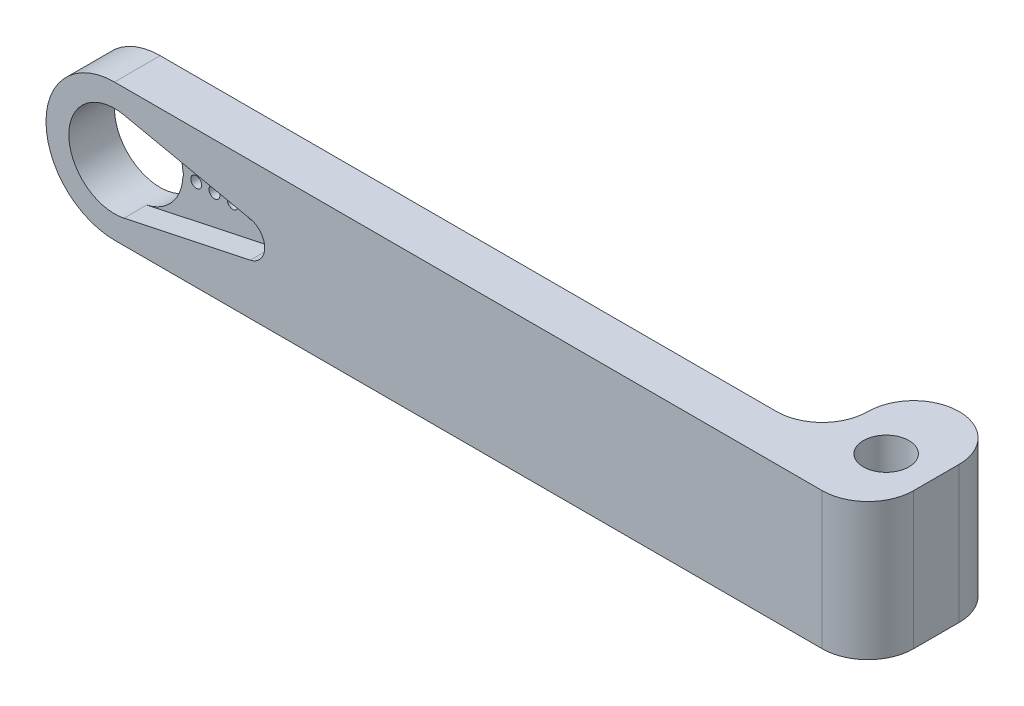
from build123d import *

# Parameters (mm, degrees)
SKETCH1_R           = 5
SKETCH1_R_2         = 2.5
BOSS_EXTRUDE1_DEPTH = 5
SKETCH2_R           = 0.6
CUT_EXTRUDE1_DEPTH  = 83.990963363
CUT_EXTRUDE2_START  = -2.5
CUT_EXTRUDE2_DEPTH  = 2.5
SKETCH4_W           = 10
SKETCH4_H           = 15
BOSS_EXTRUDE2_DEPTH = 15
SKETCH5_R           = 2.5
CUT_EXTRUDE3_DEPTH  = 15
FILLET1_R           = 5


with BuildPart() as part:
    # Sketch1 → Boss-Extrude1 (new body)
    with BuildSketch(Plane.XY):
        with BuildLine():
            Line((0, 7.5), (75, 7.5))
            ThreePointArc((75, 7.5), (82.5, 0), (75, -7.5))
            Line((75, -7.5), (0, -7.5))
            ThreePointArc((0, -7.5), (-7.5, 0), (0, 7.5))
        make_face()
        Circle(SKETCH1_R, mode=Mode.SUBTRACT)
        with Locations((75, 0)):
            Circle(SKETCH1_R_2, mode=Mode.SUBTRACT)
    extrude(amount=BOSS_EXTRUDE1_DEPTH)

    # Sketch2 → Cut-Extrude1 (cut, through all)
    with BuildSketch(Plane.XY.offset(5)):
        with Locations((4.45, 0)):
            Circle(SKETCH2_R)
        with Locations((6.45, 0)):
            Circle(SKETCH2_R)
        with Locations((8.45, 0)):
            Circle(SKETCH2_R)
        with Locations((10.45, 0)):
            Circle(SKETCH2_R)
        with Locations((12.45, 0)):
            Circle(SKETCH2_R)
        with Locations((14.45, 0)):
            Circle(SKETCH2_R)
    extrude(amount=-CUT_EXTRUDE1_DEPTH, mode=Mode.SUBTRACT)

    # Sketch3 → Cut-Extrude2 (cut)
    with BuildSketch(Plane.XY.offset(5).offset(CUT_EXTRUDE2_START)):
        with BuildLine():
            Line((14.865224913, 1.956422314), (1.038062284, 4.891055785))
            ThreePointArc((1.038062284, 4.891055785), (5, 0), (1.038062284, -4.891055785))
            Line((1.038062284, -4.891055785), (14.865224913, -1.956422314))
            ThreePointArc((14.865224913, -1.956422314), (16.45, 0), (14.865224913, 1.956422314))
        make_face()
    extrude(amount=CUT_EXTRUDE2_DEPTH, mode=Mode.SUBTRACT)

    # Sketch4 → Boss-Extrude2 (add)
    with BuildSketch(Plane(origin=(0, 7.5, 0), x_dir=(1, 0, 0), z_dir=(0, 1, 0))):
        with Locations((77.5, 2.5)):
            Rectangle(SKETCH4_W, SKETCH4_H)
    extrude(amount=-BOSS_EXTRUDE2_DEPTH)

    # Sketch5 → Cut-Extrude3 (cut)
    with BuildSketch(Plane(origin=(0, 7.5, 0), x_dir=(1, 0, 0), z_dir=(0, 1, 0))):
        with Locations(Location((77.5, 2, 0), (0, 0, 270))):
            Circle(SKETCH5_R)
    extrude(amount=-CUT_EXTRUDE3_DEPTH, mode=Mode.SUBTRACT)

    # Fillet1
    fillet1_edges = [part.edges().sort_by_distance(p)[0] for p in [
        (82.5, 0, -10),
        (72.5, 0, -10),
        (72.5, 0, 0),
        (82.5, -3.75, 5),
    ]]
    fillet(fillet1_edges, radius=FILLET1_R - 0.0001)  # a hair under: the kernel refuses the full size


solid = part.part
